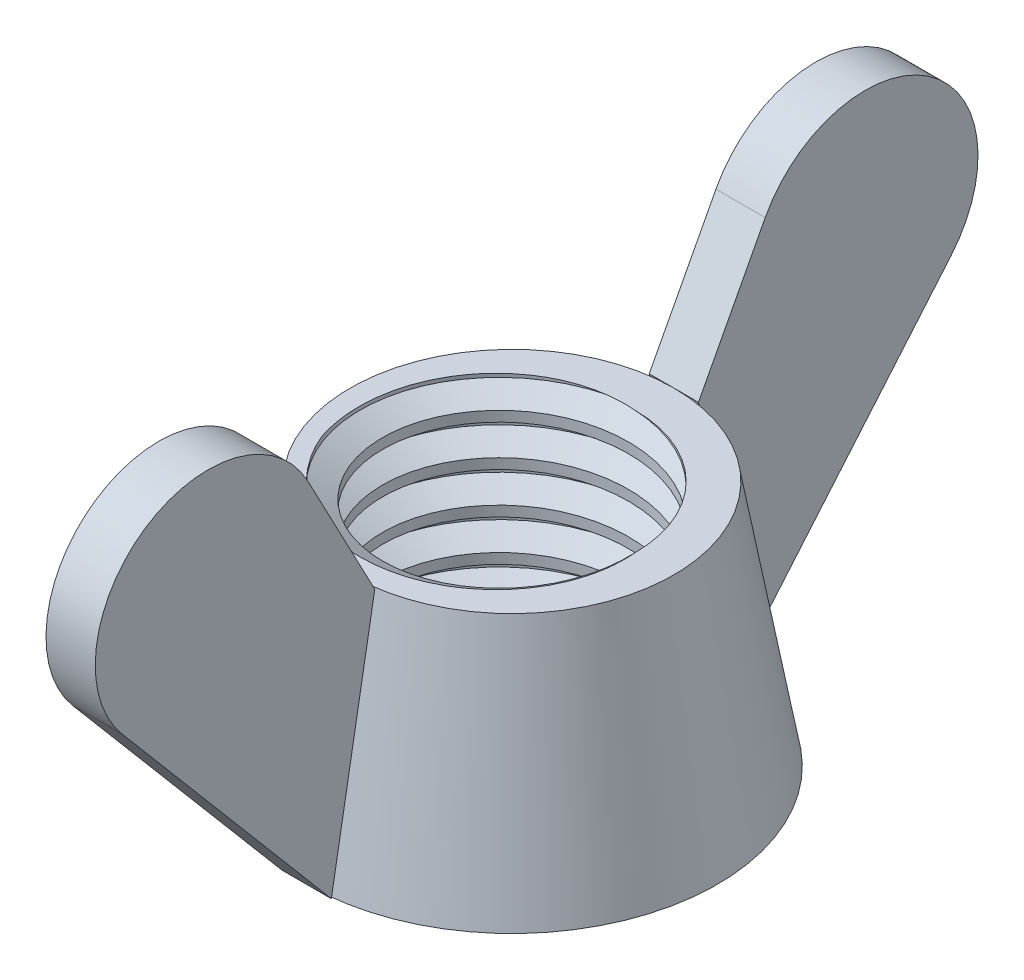
from build123d import *

# Parameters (mm, degrees)
SKETCH1_R             = 5
BOSS_EXTRUDE1_DEPTH   = 6
BOSS_EXTRUDE1_TAPER   = 10
SKETCH2_R             = 3
CUT_EXTRUDE1_DEPTH    = 10.273618668
BOSS_EXTRUDE2_DEPTH   = 0.6
BOSS_EXTRUDE2_2_DEPTH = 0.6
THREAD1_PITCH         = 1


with BuildPart() as part:
    # Sketch1 → Boss-Extrude1 (new body)
    with BuildSketch(Plane(origin=(0, 0, 0), x_dir=(1, 0, 0), z_dir=(0, 1, 0))):
        Circle(SKETCH1_R)
    extrude(amount=BOSS_EXTRUDE1_DEPTH, taper=BOSS_EXTRUDE1_TAPER)

    # Sketch2 → Cut-Extrude1 (cut, through all)
    with BuildSketch(Plane.XZ):
        with Locations(Location((0, 0, 0), (0, 0, 270))):
            Circle(SKETCH2_R)
    extrude(amount=-CUT_EXTRUDE1_DEPTH, mode=Mode.SUBTRACT)

    # Thread1: arcs per turn and ends read off the stored shape
    # Thread1: the profile of Thread Profile1 profile screwed along a right-hand helix through 7 turns, 8 arcs to a turn; built about Z, then put on its axis
    thread1_z = Axis((0, 0, 0), (0, 0, 1))
    thread1_corners = [(2.9997, 0, -0.000173205), (3.541265875, 0, 0.312499999), (3.541265875, 0, 0.437499999), (2.9997, 0, 0.750173202)]
    with BuildLine(mode=Mode.PRIVATE) as thread1_profile:
        Line(thread1_corners[0], thread1_corners[1])
        Line(thread1_corners[1], thread1_corners[2])
        Line(thread1_corners[2], thread1_corners[3])
        Line(thread1_corners[3], thread1_corners[0])
    thread1_cap = Face(thread1_profile.wire())
    thread1_turn_angles = [0, 22.5, 45, 67.5, 90, 112.5, 135, 157.5, 180, 202.5, 225, 247.5, 270, 292.5, 315, 337.5, 360]
    thread1_turn_weights = [1, 0.9238795325112867, 1, 0.9238795325112867, 1, 0.9238795325112867, 1, 0.9238795325112867, 1, 0.9238795325112867, 1, 0.9238795325112867, 1, 0.9238795325112867, 1, 0.9238795325112867, 1]
    thread1_turn_rails = [Edge.make_bspline([Vector(p[0], p[1], 0).rotate(thread1_z, thread1_turn_angles[k]) / thread1_turn_weights[k] + Vector(0, 0, p[2] + THREAD1_PITCH * thread1_turn_angles[k] / 360) for k in range(17)], [0, 0, 0, 1, 1, 2, 2, 3, 3, 4, 4, 5, 5, 6, 6, 7, 7, 8, 8, 8], 2, thread1_turn_weights) for p in thread1_corners]
    thread1_turn_sides = [Face.make_surface_from_curves(thread1_turn_rails[p[0]], thread1_turn_rails[p[1]]) for p in [(0, 1), (1, 2), (2, 3), (3, 0)]]
    thread1 = Plane(origin=(0, -1, 0), x_dir=(1, 0, 0), z_dir=(0, 1, 0)) * Solid(Shell([*[p.moved(Location((0, 0, THREAD1_PITCH * i))) for i in range(7) for p in thread1_turn_sides], thread1_cap, thread1_cap.rotate(thread1_z, 2520).moved(Location((0, 0, THREAD1_PITCH * 2520 / 360)))]))
    add(thread1, mode=Mode.SUBTRACT)


with BuildPart() as body_2:
    # Sketch3 → Boss-Extrude2 (new, symmetric)
    with BuildSketch(Plane(origin=(0, 0, 0), x_dir=(0, 0, -1), z_dir=(1, 0, 0))):
        with BuildLine():
            Line((-5, 0), (-10.09890497, 6.023177576))
            ThreePointArc((-10.09890497, 6.023177576), (-9.538797734, 10.079166851), (-5.567439097, 9.082633015))
            Line((-5.567439097, 9.082633015), (-3.942038116, 6))
            Line((-3.942038116, 6), (-5, 0))
        make_face()
    extrude(amount=BOSS_EXTRUDE2_DEPTH, both=True)


with BuildPart() as body_3:
    # Sketch3 → Boss-Extrude2 2 (new, symmetric)
    with BuildSketch(Plane(origin=(0, 0, 0), x_dir=(0, 0, -1), z_dir=(1, 0, 0))):
        with BuildLine():
            Line((5, 0), (10.09890497, 6.023177576))
            ThreePointArc((10.09890497, 6.023177576), (9.538797734, 10.079166851), (5.567439097, 9.082633015))
            Line((5.567439097, 9.082633015), (3.942038116, 6))
            Line((3.942038116, 6), (5, 0))
        make_face()
    extrude(amount=BOSS_EXTRUDE2_2_DEPTH, both=True)


solid = Compound([part.part, body_2.part, body_3.part])
